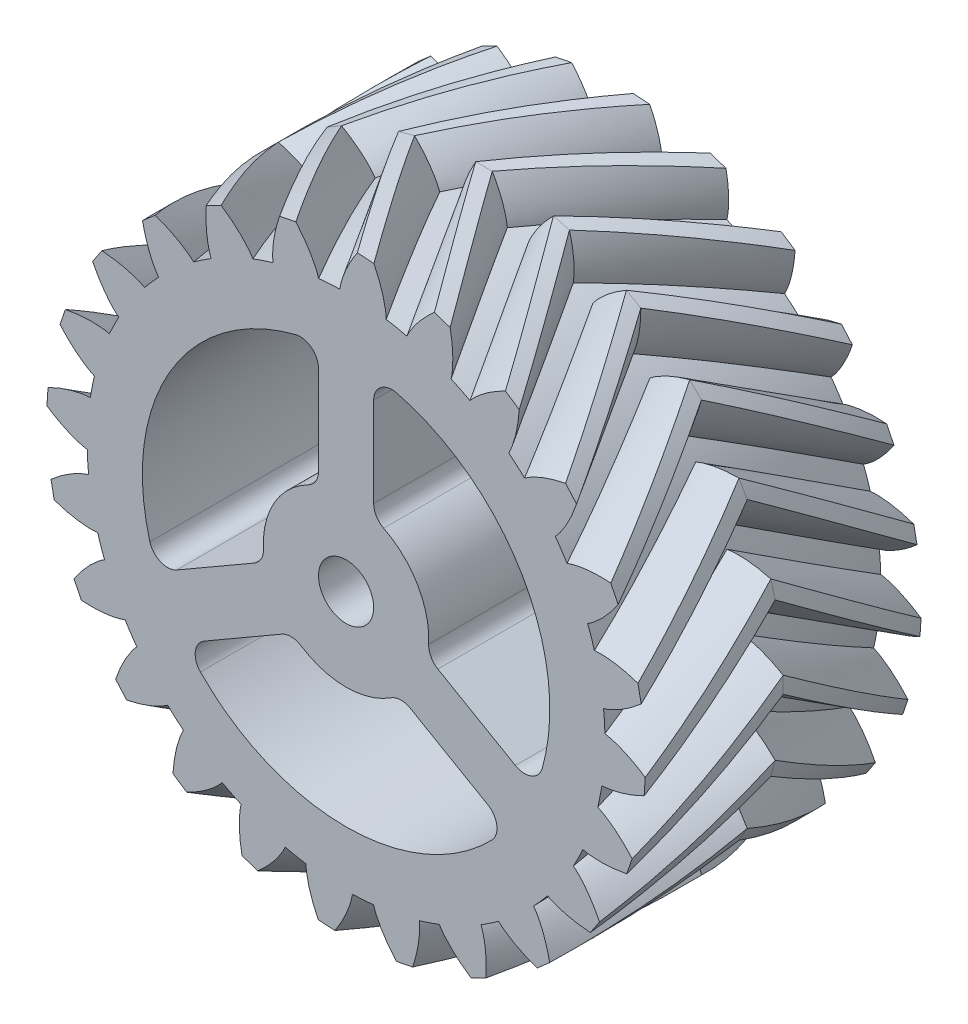
from build123d import *

# Parameters (mm, degrees)
SKETCH5_R                    = 14.078874537
SKETCH5_R_2                  = 1.5
EXTRUDE_BODY_DEPTH           = 7.5
SWEEP_HALF_TOOTH_PITCH       = 144
SWEEP_HALF_TOOTH_HEIGHT      = 7.5
SWEEP_HALF_TOOTH_RADIUS      = 14.078874537
SWEEP_HALF_TOOTH_START_ANGLE = 90
PATTERN_HALF_TEETH_COUNT     = 24
CUT_SPOKE_DEPTH              = 25.212673356
PATTERN_SPOKES_COUNT         = 3


with BuildPart() as part:
    # Sketch5 → Extrude Body (new body)
    with BuildSketch(Plane.XY):
        Circle(SKETCH5_R)
        Circle(SKETCH5_R_2, mode=Mode.SUBTRACT)
    extrude(amount=EXTRUDE_BODY_DEPTH)

    # Sweep Half Tooth: sweep along a helix
    with BuildLine() as sweep_half_tooth_path:
        add(Helix(SWEEP_HALF_TOOTH_PITCH, SWEEP_HALF_TOOTH_HEIGHT, SWEEP_HALF_TOOTH_RADIUS, center=(0, 0, 0), direction=(0, 0, 1), lefthand=True, mode=Mode.PRIVATE).rotate(Axis((0, 0, 0), (0, 0, 1)), SWEEP_HALF_TOOTH_START_ANGLE))
    # Sketch6 → Sweep Half Tooth (sweep)
    with BuildSketch(Plane.XY):
        with BuildLine():
            Line((1.274269027, 13.788607604), (0.138033757, 1.493635391))
            ThreePointArc((0.138033757, 1.493635391), (0, 1.5), (-0.138033757, 1.493635391))
            Line((-0.138033757, 1.493635391), (-1.274269027, 13.788607604))
            add(Edge.make_bspline(
                [(-1.274269027, 13.788607604), (-1.281655886, 14.009204475), (-1.145793676, 14.886152234), (-0.779387603, 15.700986555), (-0.45055771, 16.272638198)],
                knots=[0, 0, 0, 0, 0.250018961, 1, 1, 1, 1], degree=3))
            ThreePointArc((-0.45055771, 16.272638198), (0, 16.278874537), (0.45055771, 16.272638198))
            add(Edge.make_bspline(
                [(1.274269027, 13.788607604), (1.281655886, 14.009204475), (1.145793676, 14.886152234), (0.779387603, 15.700986555), (0.45055771, 16.272638198)],
                knots=[0, 0, 0, 0, 0.250018961, 1, 1, 1, 1], degree=3))
        make_face()
    sweep_half_tooth = sweep(path=sweep_half_tooth_path.line, is_frenet=True)

    # Pattern Half Teeth: Sweep Half Tooth ×24 about axis
    pattern_half_teeth_axis = Axis((0, 0, 7.5), (0, 0, -1))
    for i in range(1, PATTERN_HALF_TEETH_COUNT):
        add(sweep_half_tooth.rotate(pattern_half_teeth_axis, i * 360 / PATTERN_HALF_TEETH_COUNT))

    # Sketch8 → Cut Spoke (cut, symmetric)
    with BuildSketch(Plane.XY):
        with BuildLine():
            Line((1.5, 9.763898398), (1.5, 4.898979486))
            ThreePointArc((1.5, 4.898979486), (1.647197135, 4.376746518), (2.045454545, 4.008255943))
            ThreePointArc((2.045454545, 4.008255943), (3.897114317, 2.25), (4.493978744, -0.232712373))
            ThreePointArc((4.493978744, -0.232712373), (4.613972238, -0.761858695), (4.992640687, -1.150451637))
            Line((4.992640687, -1.150451637), (9.205784053, -3.582911093))
            ThreePointArc((9.205784053, -3.582911093), (10.083315936, -3.642882276), (10.668766975, -2.986448098))
            ThreePointArc((10.668766975, -2.986448098), (9.594586794, 5.539437268), (2.748043568, 10.732647276))
            ThreePointArc((2.748043568, 10.732647276), (1.886829374, 10.553848893), (1.5, 9.763898398))
        make_face()
    cut_spoke = extrude(amount=CUT_SPOKE_DEPTH, both=True, mode=Mode.SUBTRACT)

    # Pattern Spokes: Cut Spoke ×3 about axis
    pattern_spokes_axis = Axis((0, 0, 0), (0, 0, 1))
    for i in range(1, PATTERN_SPOKES_COUNT):
        add(cut_spoke.rotate(pattern_spokes_axis, i * 360 / PATTERN_SPOKES_COUNT), mode=Mode.SUBTRACT)

    # Mirror Body: part across plane


with BuildPart() as part_1:
    add(part.part)
    add(part.part.mirror(Plane.XY))


solid = part_1.part
